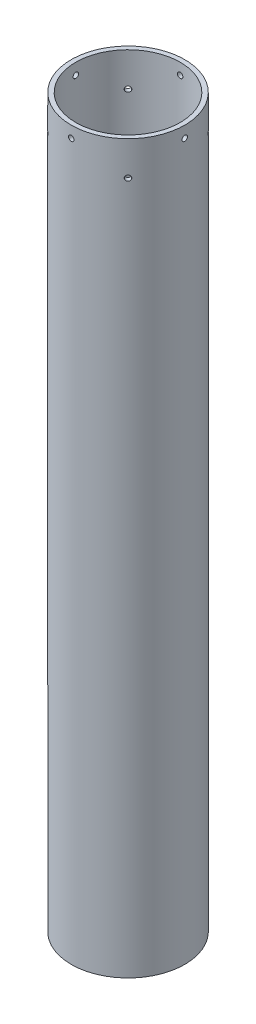
from build123d import *

# Parameters (mm, degrees)
SKETCH_1_R               = 25
SKETCH_1_R_2             = 23
EXTRUDE_1_DEPTH          = 320
SKETCH_2_R               = 1.2
CUT_EXTRUDE_1_DEPTH      = 322.94720064
PATTERN_CIRCULAR_1_COUNT = 4
SKETCH_3_R               = 1.2
CUT_EXTRUDE_2_DEPTH      = 322.947200756
PATTERN_CIRCULAR_2_COUNT = 4


with BuildPart() as part:
    # Эскиз1 → Бобышка-Вытянуть1 (new body)
    with BuildSketch(Plane(origin=(0, 0, 0), x_dir=(1, 0, 0), z_dir=(0, 1, 0))):
        Circle(SKETCH_1_R)
        Circle(SKETCH_1_R_2, mode=Mode.SUBTRACT)
    extrude(amount=EXTRUDE_1_DEPTH)

    # Эскиз2 → Вырез-Вытянуть1 (cut, through all)
    with BuildSketch(Plane(origin=(0, 0, 0), x_dir=(0, 0, -1), z_dir=(1, 0, 0))):
        with Locations((0, 315)):
            Circle(SKETCH_2_R)
    cut_extrude_1 = extrude(amount=-CUT_EXTRUDE_1_DEPTH, mode=Mode.SUBTRACT)

    # Круговой массив1: Вырез-Вытянуть1 ×4 about axis
    pattern_circular_1_axis = Axis((0, 320, 0), (0, -1, 0))
    for i in range(1, PATTERN_CIRCULAR_1_COUNT):
        add(cut_extrude_1.rotate(pattern_circular_1_axis, i * 360 / PATTERN_CIRCULAR_1_COUNT), mode=Mode.SUBTRACT)

    # Эскиз3 → Вырез-Вытянуть2 (cut, through all)
    with BuildSketch(Plane(origin=(0, 0, 0), x_dir=(0, -1, 0), z_dir=(-0.7071067811865488, 0, 0.7071067811865464))):
        with Locations((-305, 0)):
            Circle(SKETCH_3_R)
    cut_extrude_2 = extrude(amount=-CUT_EXTRUDE_2_DEPTH, mode=Mode.SUBTRACT)

    # Круговой массив2: Вырез-Вытянуть2 ×4 about axis
    pattern_circular_2_axis = Axis((0, 320, 0), (0, -1, 0))
    for i in range(1, PATTERN_CIRCULAR_2_COUNT):
        add(cut_extrude_2.rotate(pattern_circular_2_axis, i * 360 / PATTERN_CIRCULAR_2_COUNT), mode=Mode.SUBTRACT)


solid = part.part
